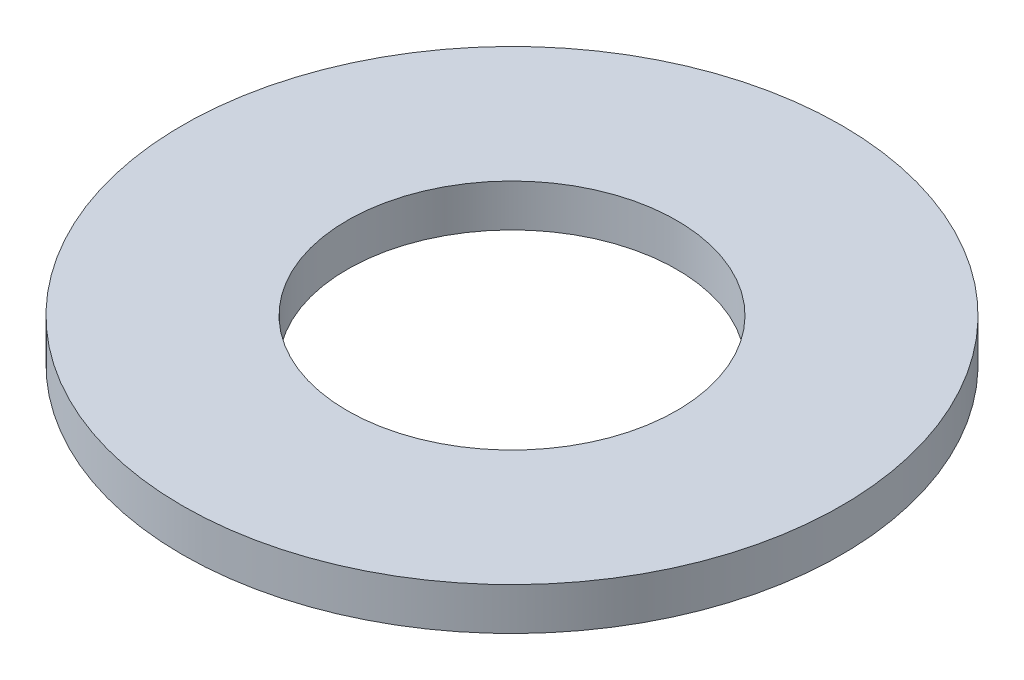
from build123d import *

# Parameters (mm, degrees)
SKETCH1_R           = 70
BOSS_EXTRUDE1_DEPTH = 9
SKETCH2_R           = 35
CUT_EXTRUDE1_DEPTH  = 100.403219264


with BuildPart() as part:
    # Sketch1 → Boss-Extrude1 (new body)
    with BuildSketch(Plane(origin=(0, 0, 0), x_dir=(1, 0, 0), z_dir=(0, 1, 0))):
        Circle(SKETCH1_R)
    extrude(amount=BOSS_EXTRUDE1_DEPTH)

    # Sketch2 → Cut-Extrude1 (cut, through all)
    with BuildSketch(Plane(origin=(0, 0, 0), x_dir=(1, 0, 0), z_dir=(0, 1, 0))):
        Circle(SKETCH2_R)
    extrude(amount=CUT_EXTRUDE1_DEPTH, mode=Mode.SUBTRACT)


solid = part.part
